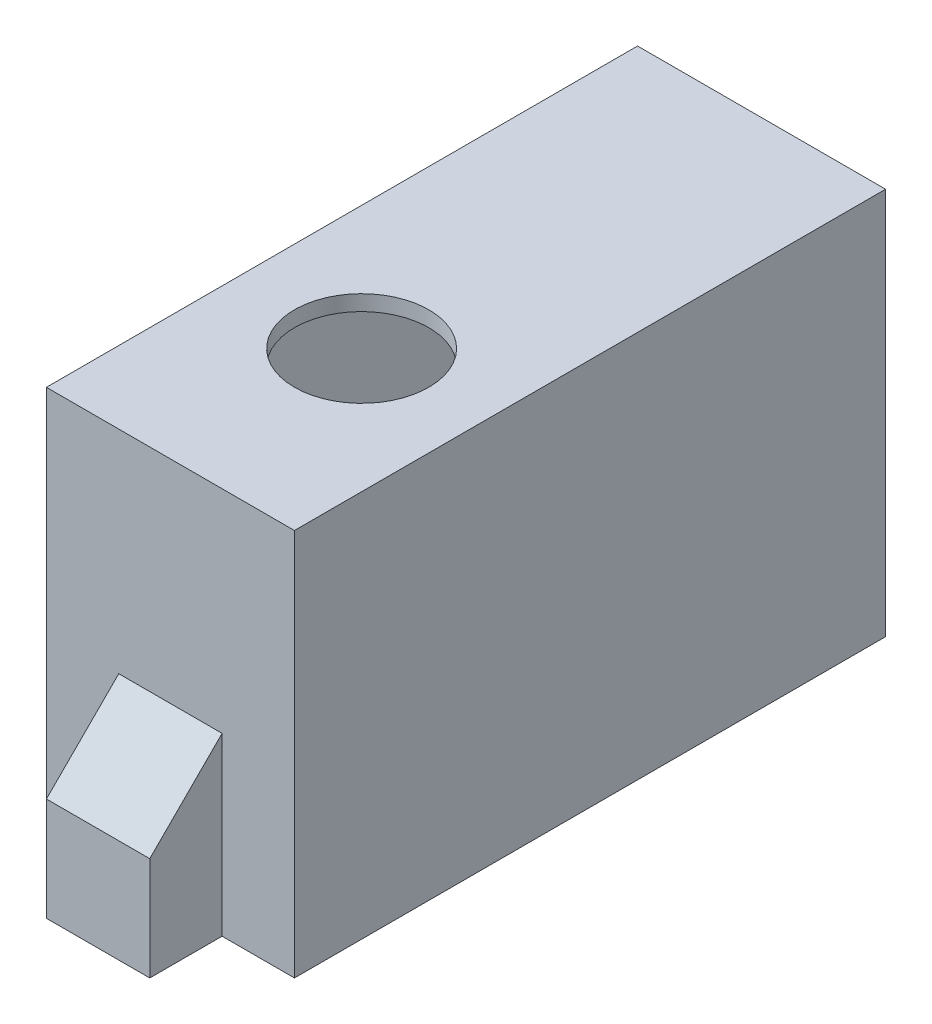
from build123d import *

# Parameters (mm, degrees)
SKETCH1_W           = 20
SKETCH1_H           = 53.2
BOSS_EXTRUDE1_DEPTH = 36
SHELL1_T            = 2
SKETCH2_R           = 6.5
CUT_EXTRUDE1_DEPTH  = 5
SKETCH3_W           = 10
SKETCH3_H           = 10
BOSS_EXTRUDE2_DEPTH = 7
SKETCH4_W           = 10
SKETCH4_H           = 10
BOSS_EXTRUDE3_DEPTH = 7
SKETCH5_R           = 1.75
CUT_EXTRUDE2_DEPTH  = 7
CHAMFER1_SIZE       = 7
SKETCH6_W           = 29.413997259
SKETCH6_H           = 62.11470898
CUT_EXTRUDE3_DEPTH  = 0.5


with BuildPart() as part:
    # Sketch1 → Boss-Extrude1 (new body)
    with BuildSketch(Plane(origin=(0, 0, 0), x_dir=(1, 0, 0), z_dir=(0, 1, 0))):
        Rectangle(SKETCH1_W, SKETCH1_H)
    extrude(amount=BOSS_EXTRUDE1_DEPTH)

    # Shell1
    shell1_openings = [part.faces().sort_by_distance(p)[0] for p in [
        (0, 0, 0),
    ]]
    offset(amount=SHELL1_T, openings=shell1_openings, kind=Kind.INTERSECTION)

    # Sketch2 → Cut-Extrude1 (cut)
    with BuildSketch(Plane(origin=(0, 38, 0), x_dir=(1, 0, 0), z_dir=(0, 1, 0))):
        with Locations(Location((0, -10.1, 0), (0, 0, 270))):
            Circle(SKETCH2_R)
    extrude(amount=-CUT_EXTRUDE1_DEPTH, mode=Mode.SUBTRACT)

    # Sketch3 → Boss-Extrude2 (add)
    with BuildSketch(Plane(origin=(0, 0, -28.6), x_dir=(-1, 0, 0), z_dir=(0, 0, -1))):
        with Locations((0, 5)):
            Rectangle(SKETCH3_W, SKETCH3_H)
    extrude(amount=BOSS_EXTRUDE2_DEPTH)

    # Sketch4 → Boss-Extrude3 (add)
    with BuildSketch(Plane.XY.offset(28.6)):
        with Locations((0, 5)):
            Rectangle(SKETCH4_W, SKETCH4_H)
    extrude(amount=BOSS_EXTRUDE3_DEPTH)

    # Sketch5 → Cut-Extrude2 (cut)
    with BuildSketch(Plane.XZ):
        with Locations(Location((0, 31.6, 0), (0, 0, 270))):
            Circle(SKETCH5_R)
        with Locations(Location((0, -31.6, 0), (0, 0, 270))):
            Circle(SKETCH5_R)
    extrude(amount=-CUT_EXTRUDE2_DEPTH, mode=Mode.SUBTRACT)

    # Chamfer1
    chamfer1_edges = [part.edges().sort_by_distance(p)[0] for p in [
        (0, 10, -28.6),
        (0, 10, 28.6),
    ]]
    chamfer(chamfer1_edges, length=CHAMFER1_SIZE - 0.0001)  # a hair under: the kernel refuses the full size

    # Sketch6 → Cut-Extrude3 (cut)
    with BuildSketch(Plane(origin=(0, 38, 0), x_dir=(1, 0, 0), z_dir=(0, 1, 0))):
        with Locations((0.367646398, -0.2519266)):
            Rectangle(SKETCH6_W, SKETCH6_H)
    extrude(amount=-CUT_EXTRUDE3_DEPTH, mode=Mode.SUBTRACT)


solid = part.part
